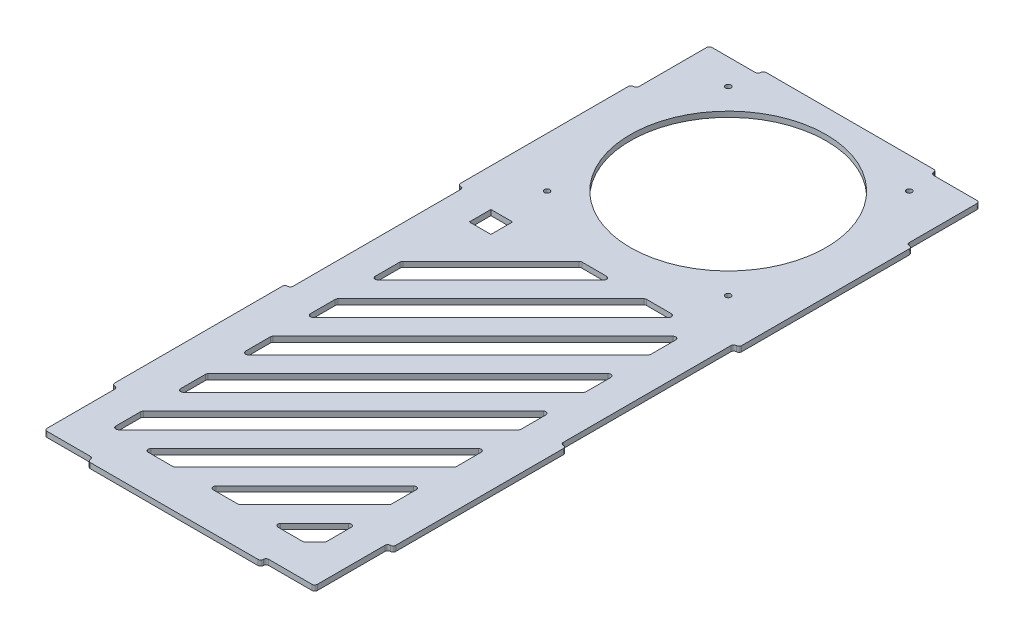
from build123d import *

# Parameters (mm, degrees)
SKETCH1_W           = 158.75
SKETCH1_H           = 390.525
BOSS_EXTRUDE1_DEPTH = 3.175
SKETCH2_W           = 101.6
SKETCH2_H           = 3.175
BOSS_EXTRUDE2_DEPTH = 3.175
SKETCH3_W           = 3.175
SKETCH3_H           = 101.6
BOSS_EXTRUDE3_DEPTH = 3.175
SKETCH4_R           = 1.5875
SKETCH4_R_2         = 57.5
CUT_EXTRUDE1_DEPTH  = 426.710554544
CUT_EXTRUDE2_DEPTH  = 426.710554544
FILLET1_R           = 1.5875
FILLET2_R           = 1.5875
SKETCH7_W           = 12.7
SKETCH7_H           = 12.7
CUT_EXTRUDE3_DEPTH  = 426.710554544


with BuildPart() as part:
    # Sketch1 → Boss-Extrude1 (new body)
    with BuildSketch(Plane(origin=(0, 0, 0), x_dir=(1, 0, 0), z_dir=(0, 1, 0))):
        with Locations((79.375, 195.2625)):
            Rectangle(SKETCH1_W, SKETCH1_H)
    extrude(amount=BOSS_EXTRUDE1_DEPTH)

    # Sketch2 → Boss-Extrude2 (add)
    with BuildSketch(Plane(origin=(0, 0, 0), x_dir=(1, 0, 0), z_dir=(0, 1, 0))):
        with Locations((79.375, 392.1125)):
            Rectangle(SKETCH2_W, SKETCH2_H)
        with Locations((79.375, -1.5875)):
            Rectangle(SKETCH2_W, SKETCH2_H)
    extrude(amount=BOSS_EXTRUDE2_DEPTH)

    # Sketch3 → Boss-Extrude3 (add)
    with BuildSketch(Plane(origin=(0, 0, 0), x_dir=(1, 0, 0), z_dir=(0, 1, 0))):
        with Locations((-1.5875, 296.8625)):
            Rectangle(SKETCH3_W, SKETCH3_H)
        with Locations((-1.5875, 93.6625)):
            Rectangle(SKETCH3_W, SKETCH3_H)
        with Locations((160.3375, 93.6625)):
            Rectangle(SKETCH3_W, SKETCH3_H)
        with Locations((160.3375, 296.8625)):
            Rectangle(SKETCH3_W, SKETCH3_H)
    extrude(amount=BOSS_EXTRUDE3_DEPTH)

    # Sketch4 → Cut-Extrude1 (cut, through all)
    with BuildSketch(Plane(origin=(0, 3.175, 0), x_dir=(1, 0, 0), z_dir=(0, 1, 0))):
        with Locations(Location((26.19375, 375.4374, 0), (0, 0, 270))):
            Circle(SKETCH4_R)
        with Locations(Location((132.55625, 375.4374, 0), (0, 0, 270))):
            Circle(SKETCH4_R)
        with Locations(Location((26.19375, 269.0749, 0), (0, 0, 270))):
            Circle(SKETCH4_R)
        with Locations(Location((132.55625, 269.0749, 0), (0, 0, 270))):
            Circle(SKETCH4_R)
        with Locations(Location((79.375, 322.25615, 0), (0, 0, 270))):
            Circle(SKETCH4_R_2)
    extrude(amount=-CUT_EXTRUDE1_DEPTH, mode=Mode.SUBTRACT)

    # Sketch5 → Cut-Extrude2 (cut, through all)
    with BuildSketch(Plane(origin=(0, 3.175, 0), x_dir=(1, 0, 0), z_dir=(0, 1, 0))):
        Polygon((71.75615, 243.20615), (19.05, 190.5), (19.05, 171.45), (90.80615, 243.20615), align=None)
        Polygon((109.85615, 243.20615), (19.05, 152.4), (19.05, 133.35), (128.90615, 243.20615), align=None)
        Polygon((139.7, 234.95), (19.05, 114.3), (19.05, 95.25), (139.7, 215.9), align=None)
        Polygon((139.7, 196.85), (19.05, 76.2), (19.05, 57.15), (139.7, 177.8), align=None)
        Polygon((139.7, 158.75), (19.05, 38.1), (19.05, 19.05), (139.7, 139.7), align=None)
        Polygon((139.7, 120.65), (38.1, 19.05), (57.15, 19.05), (139.7, 101.6), align=None)
        Polygon((139.7, 82.55), (76.2, 19.05), (95.25, 19.05), (139.7, 63.5), align=None)
        Polygon((139.7, 44.45), (114.3, 19.05), (133.35, 19.05), (139.7, 25.4), align=None)
    extrude(amount=-CUT_EXTRUDE2_DEPTH, mode=Mode.SUBTRACT)

    # Fillet1
    fillet1_edges = [part.edges().sort_by_distance(p)[0] for p in [
        (0, 1.5875, -347.6625),
        (-3.175, 1.5875, -347.6625),
        (-3.175, 1.5875, -246.0625),
        (0, 1.5875, -246.0625),
        (0, 1.5875, -144.4625),
        (-3.175, 1.5875, -144.4625),
        (-3.175, 1.5875, -42.8625),
        (0, 1.5875, -42.8625),
        (0, 1.5875, 0),
        (28.575, 1.5875, 0),
        (28.575, 1.5875, 3.175),
        (130.175, 1.5875, 3.175),
        (130.175, 1.5875, 0),
        (158.75, 1.5875, 0),
        (161.925, 1.5875, -42.8625),
        (158.75, 1.5875, -42.8625),
        (161.925, 1.5875, -144.4625),
        (158.75, 1.5875, -144.4625),
        (158.75, 1.5875, -246.0625),
        (161.925, 1.5875, -246.0625),
        (161.925, 1.5875, -347.6625),
        (158.75, 1.5875, -347.6625),
        (158.75, 1.5875, -390.525),
        (130.175, 1.5875, -390.525),
        (130.175, 1.5875, -393.7),
        (28.575, 1.5875, -393.7),
        (28.575, 1.5875, -390.525),
        (0, 1.5875, -390.525),
    ]]
    fillet(fillet1_edges, radius=FILLET1_R - 0.0001)  # a hair under: the kernel refuses the full size

    # Fillet2
    fillet2_edges = [part.edges().sort_by_distance(p)[0] for p in [
        (19.05, 1.5875, -38.1),
        (139.7, 1.5875, -158.75),
        (139.7, 1.5875, -139.7),
        (19.05, 1.5875, -19.05),
        (19.05, 1.5875, -76.2),
        (139.7, 1.5875, -196.85),
        (139.7, 1.5875, -177.8),
        (19.05, 1.5875, -57.15),
        (95.25, 1.5875, -19.05),
        (76.2, 1.5875, -19.05),
        (139.7, 1.5875, -82.55),
        (139.7, 1.5875, -63.5),
        (57.15, 1.5875, -19.05),
        (38.1, 1.5875, -19.05),
        (139.7, 1.5875, -120.65),
        (139.7, 1.5875, -101.6),
        (19.05, 1.5875, -190.5),
        (71.75615, 1.5875, -243.20615),
        (90.80615, 1.5875, -243.20615),
        (19.05, 1.5875, -171.45),
        (19.05, 1.5875, -114.3),
        (139.7, 1.5875, -234.95),
        (139.7, 1.5875, -215.9),
        (19.05, 1.5875, -95.25),
        (19.05, 1.5875, -152.4),
        (109.85615, 1.5875, -243.20615),
        (128.90615, 1.5875, -243.20615),
        (19.05, 1.5875, -133.35),
        (133.35, 1.5875, -19.05),
        (114.3, 1.5875, -19.05),
        (139.7, 1.5875, -44.45),
        (139.7, 1.5875, -25.4),
    ]]
    fillet(fillet2_edges, radius=FILLET2_R)

    # Sketch7 → Cut-Extrude3 (cut, through all)
    with BuildSketch(Plane(origin=(0, 3.175, 0), x_dir=(1, 0, 0), z_dir=(0, 1, 0))):
        with Locations((25.4, 236.85615)):
            Rectangle(SKETCH7_W, SKETCH7_H)
    extrude(amount=-CUT_EXTRUDE3_DEPTH, mode=Mode.SUBTRACT)


solid = part.part
